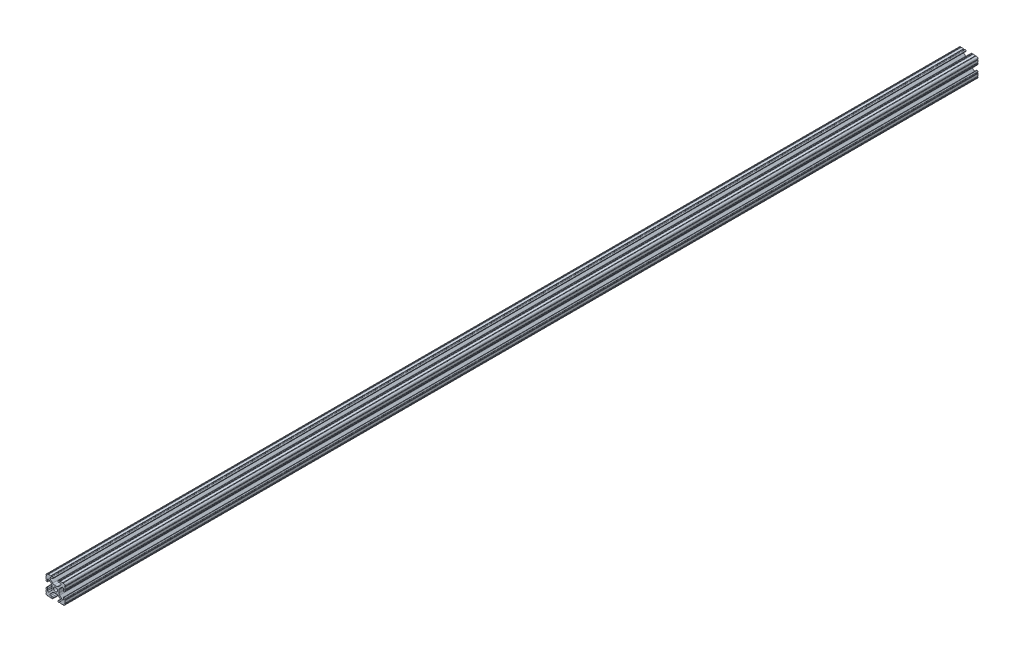
from build123d import *

# Parameters (mm, degrees)
SKETCH1_R               = 2.6035
BOSS_EXTRUDE1_DEPTH     = 609.6
CUT_EXTRUDE1_DEPTH      = 610.975067091
CUT_EXTRUDE1_DEPTH_BACK = 610.975067091
SKETCH2_R               = 3.175


with BuildPart() as part:
    # Sketch1 → Boss-Extrude1 (new, symmetric)
    with BuildSketch(Plane.XY):
        with BuildLine():
            Line((-7.179650497, -8.645192506), (-3.952270251, -5.423690499))
            ThreePointArc((-3.952270251, -5.423690499), (-2.922936451, -4.736929036), (-1.709253557, -4.4958))
            Line((-1.709253557, -4.4958), (1.709253557, -4.4958))
            ThreePointArc((1.709253557, -4.4958), (2.922936451, -4.736929036), (3.952270251, -5.423690499))
            Line((3.952270251, -5.423690499), (7.179650497, -8.645192506))
            ThreePointArc((7.179650497, -8.645192506), (7.41473083, -9.822813117), (6.416408329, -10.4902))
            Line((6.416408329, -10.4902), (4.287512407, -10.4902))
            ThreePointArc((4.287512407, -10.4902), (3.54574862, -10.79744862), (3.2385, -11.539212407))
            Line((3.2385, -11.539212407), (3.2385, -11.650987593))
            ThreePointArc((3.2385, -11.650987593), (3.54574862, -12.39275138), (4.287512407, -12.7))
            Line((4.287512407, -12.7), (5.317126718, -12.7))
            ThreePointArc((5.317126718, -12.7), (5.825126718, -12.192), (6.333126718, -12.7))
            Line((6.333126718, -12.7), (9.550443118, -12.7))
            ThreePointArc((9.550443118, -12.7), (10.058366869, -12.192000006), (10.566443095, -12.699847501))
            ThreePointArc((10.566443095, -12.699847501), (12.082537762, -12.08250727), (12.699846982, -10.566399977))
            ThreePointArc((12.699846982, -10.566399977), (12.192000006, -10.058323491), (12.7, -9.5504))
            Line((12.7, -9.5504), (12.7, -6.3330836))
            ThreePointArc((12.7, -6.3330836), (12.192, -5.8250836), (12.7, -5.3170836))
            Line((12.7, -5.3170836), (12.7, -4.287469289))
            ThreePointArc((12.7, -4.287469289), (12.39275138, -3.545705502), (11.650987593, -3.238456882))
            Line((11.650987593, -3.238456882), (11.539212407, -3.238456882))
            ThreePointArc((11.539212407, -3.238456882), (10.79744862, -3.545705502), (10.4902, -4.287469289))
            Line((10.4902, -4.287469289), (10.4902, -6.402089023))
            ThreePointArc((10.4902, -6.402089023), (9.856505071, -7.351067942), (8.737131347, -7.129408934))
            Line((8.737131347, -7.129408934), (5.441005833, -3.840816462))
            ThreePointArc((5.441005833, -3.840816462), (4.750877967, -2.809883091), (4.5085, -1.593185507))
            Line((4.5085, -1.593185507), (4.5085, 1.593185507))
            ThreePointArc((4.5085, 1.593185507), (4.750877967, 2.809883091), (5.441005833, 3.840816462))
            Line((5.441005833, 3.840816462), (8.737131347, 7.129408934))
            ThreePointArc((8.737131347, 7.129408934), (9.856505071, 7.351067942), (10.4902, 6.402089023))
            Line((10.4902, 6.402089023), (10.4902, 4.287469289))
            ThreePointArc((10.4902, 4.287469289), (10.79744862, 3.545705502), (11.539212407, 3.238456882))
            Line((11.539212407, 3.238456882), (11.650987593, 3.238456882))
            ThreePointArc((11.650987593, 3.238456882), (12.39275138, 3.545705502), (12.7, 4.287469289))
            Line((12.7, 4.287469289), (12.7, 5.3170836))
            ThreePointArc((12.7, 5.3170836), (12.192, 5.8250836), (12.7, 6.3330836))
            Line((12.7, 6.3330836), (12.7, 9.5504))
            ThreePointArc((12.7, 9.5504), (12.192000006, 10.058323491), (12.699846982, 10.566399977))
            ThreePointArc((12.699846982, 10.566399977), (12.082537762, 12.08250727), (10.566443095, 12.699847501))
            ThreePointArc((10.566443095, 12.699847501), (10.058366869, 12.192000006), (9.550443118, 12.7))
            Line((9.550443118, 12.7), (6.333126718, 12.7))
            ThreePointArc((6.333126718, 12.7), (5.825126718, 12.192), (5.317126718, 12.7))
            Line((5.317126718, 12.7), (4.287512407, 12.7))
            ThreePointArc((4.287512407, 12.7), (3.54574862, 12.39275138), (3.2385, 11.650987593))
            Line((3.2385, 11.650987593), (3.2385, 11.539212407))
            ThreePointArc((3.2385, 11.539212407), (3.54574862, 10.79744862), (4.287512407, 10.4902))
            Line((4.287512407, 10.4902), (6.476788598, 10.4902))
            ThreePointArc((6.476788598, 10.4902), (7.432222385, 9.85140422), (7.207036008, 8.724370562))
            Line((7.207036008, 8.724370562), (3.898272566, 5.423169045))
            ThreePointArc((3.898272566, 5.423169045), (2.869120213, 4.736787962), (1.655778399, 4.4958))
            Line((1.655778399, 4.4958), (-1.655778399, 4.4958))
            ThreePointArc((-1.655778399, 4.4958), (-2.869120213, 4.736787962), (-3.898272566, 5.423169045))
            Line((-3.898272566, 5.423169045), (-7.207036008, 8.724370562))
            ThreePointArc((-7.207036008, 8.724370562), (-7.432222385, 9.85140422), (-6.476788598, 10.4902))
            Line((-6.476788598, 10.4902), (-4.287512407, 10.4902))
            ThreePointArc((-4.287512407, 10.4902), (-3.54574862, 10.79744862), (-3.2385, 11.539212407))
            Line((-3.2385, 11.539212407), (-3.2385, 11.650987593))
            ThreePointArc((-3.2385, 11.650987593), (-3.54574862, 12.39275138), (-4.287512407, 12.7))
            Line((-4.287512407, 12.7), (-5.317126718, 12.7))
            ThreePointArc((-5.317126718, 12.7), (-5.825126718, 12.192), (-6.333126718, 12.7))
            Line((-6.333126718, 12.7), (-9.550443118, 12.7))
            ThreePointArc((-9.550443118, 12.7), (-10.058366869, 12.192000006), (-10.566443095, 12.699847501))
            ThreePointArc((-10.566443095, 12.699847501), (-12.082537762, 12.08250727), (-12.699846982, 10.566399977))
            ThreePointArc((-12.699846982, 10.566399977), (-12.192000006, 10.058323491), (-12.7, 9.5504))
            Line((-12.7, 9.5504), (-12.7, 6.3330836))
            ThreePointArc((-12.7, 6.3330836), (-12.192, 5.8250836), (-12.7, 5.3170836))
            Line((-12.7, 5.3170836), (-12.7, 4.287469289))
            ThreePointArc((-12.7, 4.287469289), (-12.39275138, 3.545705502), (-11.650987593, 3.238456882))
            Line((-11.650987593, 3.238456882), (-11.539212407, 3.238456882))
            ThreePointArc((-11.539212407, 3.238456882), (-10.79744862, 3.545705502), (-10.4902, 4.287469289))
            Line((-10.4902, 4.287469289), (-10.4902, 6.402089023))
            ThreePointArc((-10.4902, 6.402089023), (-9.856505071, 7.351067942), (-8.737131347, 7.129408934))
            Line((-8.737131347, 7.129408934), (-5.441005833, 3.840816462))
            ThreePointArc((-5.441005833, 3.840816462), (-4.750877967, 2.809883091), (-4.5085, 1.593185507))
            Line((-4.5085, 1.593185507), (-4.5085, -1.593185507))
            ThreePointArc((-4.5085, -1.593185507), (-4.750877967, -2.809883091), (-5.441005833, -3.840816462))
            Line((-5.441005833, -3.840816462), (-8.737131347, -7.129408934))
            ThreePointArc((-8.737131347, -7.129408934), (-9.856505071, -7.351067942), (-10.4902, -6.402089023))
            Line((-10.4902, -6.402089023), (-10.4902, -4.287469289))
            ThreePointArc((-10.4902, -4.287469289), (-10.79744862, -3.545705502), (-11.539212407, -3.238456882))
            Line((-11.539212407, -3.238456882), (-11.650987593, -3.238456882))
            ThreePointArc((-11.650987593, -3.238456882), (-12.39275138, -3.545705502), (-12.7, -4.287469289))
            Line((-12.7, -4.287469289), (-12.7, -5.3170836))
            ThreePointArc((-12.7, -5.3170836), (-12.192, -5.8250836), (-12.7, -6.3330836))
            Line((-12.7, -6.3330836), (-12.7, -9.5504))
            ThreePointArc((-12.7, -9.5504), (-12.192000006, -10.058323491), (-12.699846982, -10.566399977))
            ThreePointArc((-12.699846982, -10.566399977), (-12.082537762, -12.08250727), (-10.566443095, -12.699847501))
            ThreePointArc((-10.566443095, -12.699847501), (-10.058366869, -12.192000006), (-9.550443118, -12.7))
            Line((-9.550443118, -12.7), (-6.333126718, -12.7))
            ThreePointArc((-6.333126718, -12.7), (-5.825126718, -12.192), (-5.317126718, -12.7))
            Line((-5.317126718, -12.7), (-4.287512407, -12.7))
            ThreePointArc((-4.287512407, -12.7), (-3.54574862, -12.39275138), (-3.2385, -11.650987593))
            Line((-3.2385, -11.650987593), (-3.2385, -11.539212407))
            ThreePointArc((-3.2385, -11.539212407), (-3.54574862, -10.79744862), (-4.287512407, -10.4902))
            Line((-4.287512407, -10.4902), (-6.416408329, -10.4902))
            ThreePointArc((-6.416408329, -10.4902), (-7.41473083, -9.822813117), (-7.179650497, -8.645192506))
        make_face()
        Circle(SKETCH1_R, mode=Mode.SUBTRACT)
    extrude(amount=BOSS_EXTRUDE1_DEPTH, both=True)

    # Sketch2 → Cut-Extrude1 (cut, two sides: drawn at the far end of the back side and taken through both)
    with BuildSketch(Plane(origin=(4.5085, 0, 0), x_dir=(0, 0, -1), z_dir=(1, 0, 0)).offset(-CUT_EXTRUDE1_DEPTH_BACK)):
        with Locations((38.1, 0)):
            Circle(SKETCH2_R)
        with Locations((-38.1, 0)):
            Circle(SKETCH2_R)
        Circle(SKETCH2_R)
    extrude(amount=CUT_EXTRUDE1_DEPTH + CUT_EXTRUDE1_DEPTH_BACK, mode=Mode.SUBTRACT)


solid = part.part
